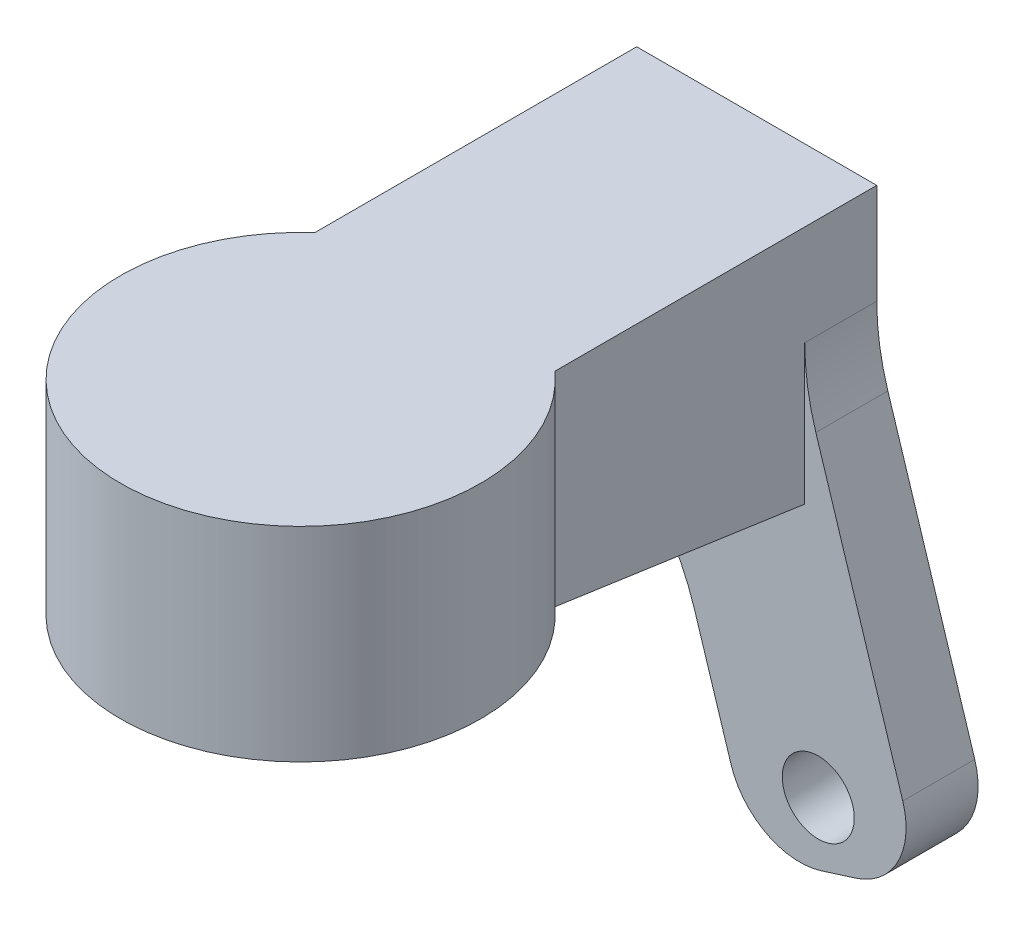
from build123d import *

# Parameters (mm, degrees)
ESBO_O2_R                = 7.5
RESSALTO_EXTRUS_O1_DEPTH = 8.5
ESBO_O3_R                = 5.75
CORTE_EXTRUS_O1_DEPTH    = 4.5
RESSALTO_EXTRUS_O2_START = -8.5
RESSALTO_EXTRUS_O2_DEPTH = 8.5
RESSALTO_EXTRUS_O3_DEPTH = 3
ESBO_O10_R               = 1.5
CORTE_EXTRUS_O2_DEPTH    = 33.179741965
FILETE2_R                = 3
RESSALTO_EXTRUS_O4_DEPTH = 10
FILETE4_R                = 10
FILETE5_R                = 10


with BuildPart() as part:
    # Esboço2 → Ressalto-extrusão1 (new body)
    with BuildSketch(Plane(origin=(0, 0, 0), x_dir=(1, 0, 0), z_dir=(0, 1, 0))):
        with Locations(Location((0, 0, 0), (0, 0, 270))):
            Circle(ESBO_O2_R)
    extrude(amount=RESSALTO_EXTRUS_O1_DEPTH)

    # Esboço3 → Corte-extrusão1 (cut)
    with BuildSketch(Plane.XZ):
        with Locations(Location((0, 0, 0), (0, 0, 270))):
            Circle(ESBO_O3_R)
    extrude(amount=-CORTE_EXTRUS_O1_DEPTH, mode=Mode.SUBTRACT)

    # Esboço4 → Ressalto-extrusão2 (add)
    with BuildSketch(Plane(origin=(0, 8.5, 0), x_dir=(1, 0, 0), z_dir=(0, 1, 0)).offset(RESSALTO_EXTRUS_O2_START)):
        with BuildLine():
            Line((5, 19), (-5, 19))
            Line((-5, 19), (-5, 5.590169944))
            ThreePointArc((-5, 5.590169944), (0, 7.5), (5, 5.590169944))
            Line((5, 5.590169944), (5, 19))
        make_face()
    extrude(amount=RESSALTO_EXTRUS_O2_DEPTH)

    # Esboço9 → Ressalto-extrusão3 (add)
    with BuildSketch(Plane(origin=(0, 0, -19), x_dir=(-1, 0, 0), z_dir=(0, 0, -1))):
        Polygon((-3.625309941, 7.143055834), (-9.985237601, -13.028057675), (-2.83236047, -15.283351171), (3.527567189, 4.887762338), (-0.053729842, 6), align=None)
    extrude(amount=-RESSALTO_EXTRUS_O3_DEPTH)

    # Esboço10 → Corte-extrusão2 (cut, through all)
    with BuildSketch(Plane(origin=(0, 0, -19), x_dir=(-1, 0, 0), z_dir=(0, 0, -1))):
        with Locations((-5.563236349, -11.800986501)):
            Circle(ESBO_O10_R)
    extrude(amount=-CORTE_EXTRUS_O2_DEPTH, mode=Mode.SUBTRACT)

    # Filete2
    filete2_edges = [part.edges().sort_by_distance(p)[0] for p in [
        (2.83236047, -15.283351171, -17.5),
        (9.985237601, -13.028057675, -17.5),
    ]]
    fillet(filete2_edges, radius=FILETE2_R)

    # Esboço12 → Ressalto-extrusão4 (add)
    with BuildSketch(Plane(origin=(5, 0, 0), x_dir=(0, 0, -1), z_dir=(1, 0, 0))):
        Polygon((16, -1.5), (5.590169944, 0), (16, 0), (19, 0), (19, -1.5), align=None)
    extrude(amount=-RESSALTO_EXTRUS_O4_DEPTH)

    # Filete4
    filete4_edges = [part.edges().sort_by_distance(p)[0] for p in [
        (5, 2.783095989, -17.5),
    ]]
    fillet(filete4_edges, radius=FILETE4_R)

    # Filete5
    # the kernel refuses this fillet: 10 mm, written as the material it adds along each edge
    with BuildSketch(Plane(origin=(-1.513513461, -1.5, -16), x_dir=(-1.0, -1.1428670067616555e-12, 0), z_dir=(0, 0, -1))) as filete5_piece_1_section:
        with BuildLine():
            CenterArc((7.613313945, -9.108748299), FILETE5_R, 114.373472149, 48.126527851)
            Line((-1.923855563, -6.101690304), (-2.114598953, -6.041549144))
            Line((-2.114598953, -6.041549144), (-0.19074339, 0.06014116))
            Line((-0.19074339, 0.06014116), (0, 0.2))
            ThreePointArc((0, 0.2), (1.74324327, 0.2), (3.403949991, 0.182174966))
            Line((3.403949991, 0.182174966), (3.486486539, 0))
        make_face()
    filete5_piece_1 = extrude(amount=3, mode=Mode.PRIVATE)
    filete5_piece_1 = split(filete5_piece_1, bisect_by=Plane(origin=(-1.609257645, -1.741830898, -17.678279033), z_dir=(0, -0.9897772969969367, 0.14262153536348515)), keep=Keep.TOP, mode=Mode.PRIVATE)
    add(filete5_piece_1)
    with BuildSketch(Plane(origin=(-1.513513461, -1.5, -16), x_dir=(-1.0, -1.1428670067616555e-12, 0), z_dir=(0, 0, -1))) as filete5_piece_2_section:
        with BuildLine():
            CenterArc((7.613313945, -9.108748299), FILETE5_R, 114.373472149, 48.126527851)
            Line((-1.923855563, -6.101690304), (-2.114598953, -6.041549144))
            Line((-2.114598953, -6.041549144), (-0.19074339, 0.06014116))
            Line((-0.19074339, 0.06014116), (0, 0.2))
            ThreePointArc((0, 0.2), (1.74324327, 0.2), (3.403949991, 0.182174966))
            Line((3.403949991, 0.182174966), (3.486486539, 0))
        make_face()
    filete5_piece_2 = extrude(amount=3, mode=Mode.PRIVATE)
    filete5_piece_2 = split(filete5_piece_2, bisect_by=Plane(origin=(-3.063320239, -1.747230158, -17.715749287), z_dir=(0, 0.9897772969969367, -0.14262153536348515)), keep=Keep.TOP, mode=Mode.PRIVATE)
    add(filete5_piece_2)
    with BuildSketch(Plane(origin=(-1.513513461, -1.5, -0.00550001), x_dir=(-1.0, -1.1395552717741066e-12, 0), z_dir=(0, 0, -1))) as filete5_piece_3_section:
        with BuildLine():
            CenterArc((7.613313945, -9.108748299), FILETE5_R, 114.373472149, 48.126527851)
            Line((-1.923855563, -6.101690304), (-2.114598953, -6.041549144))
            Line((-2.114598953, -6.041549144), (-0.19074339, 0.06014116))
            Line((-0.19074339, 0.06014116), (0, 0.2))
            ThreePointArc((0, 0.2), (1.74324327, 0.2), (3.403949991, 0.182174966))
            Line((3.403949991, 0.182174966), (3.486486539, 0))
        make_face()
    filete5_piece_3 = extrude(amount=18.99449999, mode=Mode.PRIVATE)
    filete5_piece_3 = split(filete5_piece_3, bisect_by=Plane(origin=(-3.132069725, -1.369378897, -16), z_dir=(0, 0, 1)), keep=Keep.TOP, mode=Mode.PRIVATE)
    filete5_piece_3 = split(filete5_piece_3, bisect_by=Plane(origin=(-3.132069725, -1.433360973, -15.537532703), z_dir=(0, 0.9897772969969367, -0.14262153536348515)), keep=Keep.TOP, mode=Mode.PRIVATE)
    add(filete5_piece_3)


solid = part.part
